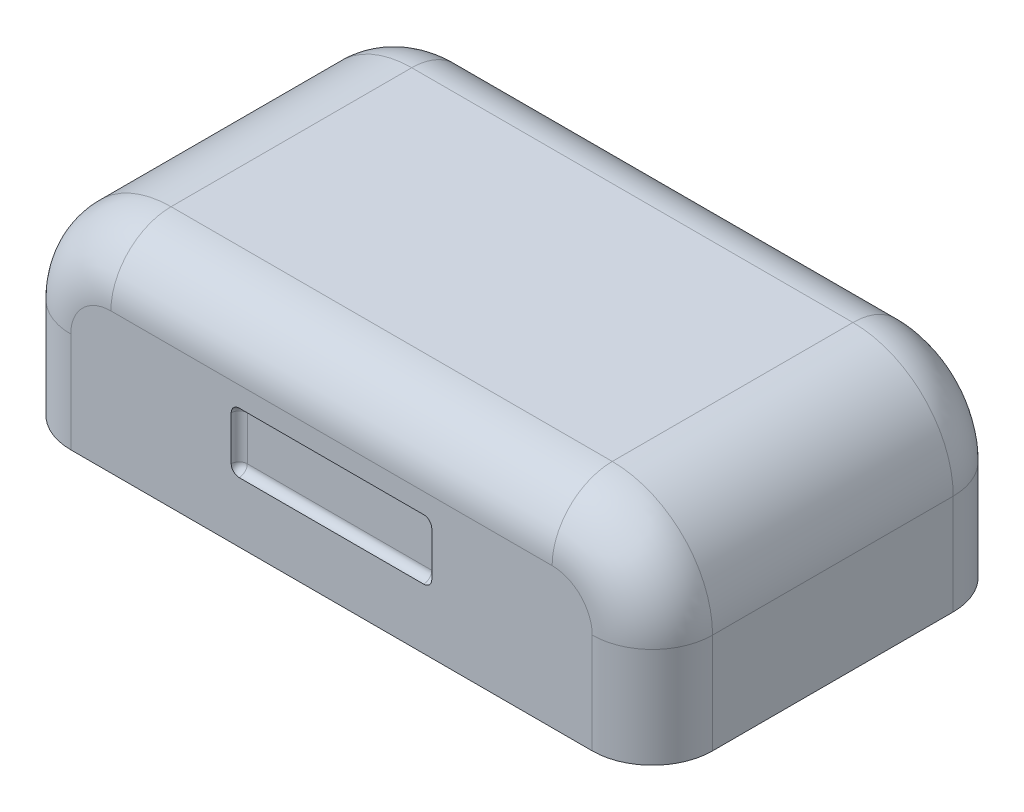
from build123d import *

# Parameters (mm, degrees)
ESQUISSE1_W             = 160
ESQUISSE1_H             = 90
EXTRUSION1_DEPTH        = 50
CONG_1_R                = 25
CONG_2_R                = 15
COQUE1_T                = -3
ESQUISSE2_W             = 50
ESQUISSE2_H             = 15
ENL_V_MAT_EXTRU_1_DEPTH = 2
CONG_4_R                = 2
CONG_5_R                = 2
CONG_6_R                = 2
CONG_7_R                = 2
CONG_4_OF_SYM_TRIE1_R   = 2
CONG_5_OF_SYM_TRIE1_R   = 2
CONG_6_OF_SYM_TRIE1_R   = 2
CONG_7_OF_SYM_TRIE1_R   = 2


with BuildPart() as part:
    # Esquisse1 → Extrusion1 (new body)
    with BuildSketch(Plane(origin=(0, 0, 0), x_dir=(1, 0, 0), z_dir=(0, 1, 0))):
        with Locations((35.341232877, 23.705753425)):
            Rectangle(ESQUISSE1_W, ESQUISSE1_H)
    extrude(amount=EXTRUSION1_DEPTH)

    # Congé1
    cong_1_edges = [part.edges().sort_by_distance(p)[0] for p in [
        (115.341232877, 50, -23.705753425),
        (-44.658767123, 50, -23.705753425),
    ]]
    fillet(cong_1_edges, radius=CONG_1_R)

    # Congé2
    cong_2_edges = [part.edges().sort_by_distance(p)[0] for p in [
        (35.341232877, 50, 21.294246575),
        (35.341232877, 50, -68.705753425),
        (115.341232877, 12.5, 21.294246575),
        (-44.658767123, 12.5, 21.294246575),
        (108.018902406, 42.67766953, 21.294246575),
        (-37.336436653, 42.67766953, 21.294246575),
        (-44.658767123, 12.5, -68.705753425),
        (115.341232877, 12.5, -68.705753425),
        (108.018902406, 42.67766953, -68.705753425),
        (-37.336436653, 42.67766953, -68.705753425),
    ]]
    fillet(cong_2_edges, radius=CONG_2_R)

    # Coque1
    coque1_openings = [part.faces().sort_by_distance(p)[0] for p in [
        (35.341232877, 0, -23.705753425),
    ]]
    offset(amount=COQUE1_T, openings=coque1_openings, kind=Kind.INTERSECTION)

    # Esquisse2 → Enlèv. mat.-Extru.1 (cut)
    with BuildSketch(Plane.XY.offset(21.294246575)):
        with Locations((35.341232877, 22.5)):
            Rectangle(ESQUISSE2_W, ESQUISSE2_H)
    enl_v_mat_extru_1 = extrude(amount=-ENL_V_MAT_EXTRU_1_DEPTH, mode=Mode.SUBTRACT)

    # Congé4
    cong_4_edges = [part.edges().sort_by_distance(p)[0] for p in [
        (35.341232877, 15, 19.294246575),
    ]]
    fillet(cong_4_edges, radius=CONG_4_R - 0.0001)  # a hair under: the kernel refuses the full size

    # Congé5
    cong_5_edges = [part.edges().sort_by_distance(p)[0] for p in [
        (35.341232877, 30, 19.294246575),
    ]]
    fillet(cong_5_edges, radius=CONG_5_R - 0.0001)  # a hair under: the kernel refuses the full size

    # Congé6
    cong_6_edges = [part.edges().sort_by_distance(p)[0] for p in [
        (10.341232877, 15.585757148, 19.880003724),
        (10.341232877, 22.5, 19.294246575),
        (10.341232877, 29.414242852, 19.880003724),
    ]]
    fillet(cong_6_edges, radius=CONG_6_R - 0.0001)  # a hair under: the kernel refuses the full size

    # Congé7
    cong_7_edges = [part.edges().sort_by_distance(p)[0] for p in [
        (60.341232877, 22.5, 19.294246575),
        (60.341232877, 15.585757148, 19.880003724),
        (60.341232877, 29.414242852, 19.880003724),
    ]]
    fillet(cong_7_edges, radius=CONG_7_R - 0.0001)  # a hair under: the kernel refuses the full size

    # Symétrie1: Enlèv. mat.-Extru.1 across plane
    add(enl_v_mat_extru_1.mirror(Plane.XY.offset(-23.705753425)), mode=Mode.SUBTRACT)

    # Congé4 of Symétrie1
    cong_4_of_sym_trie1_edges = [part.edges().sort_by_distance(p)[0] for p in [
        (35.341232877, 15, -66.705753425),
    ]]
    fillet(cong_4_of_sym_trie1_edges, radius=CONG_4_OF_SYM_TRIE1_R - 0.0001)  # a hair under: the kernel refuses the full size

    # Congé5 of Symétrie1
    cong_5_of_sym_trie1_edges = [part.edges().sort_by_distance(p)[0] for p in [
        (35.341232877, 30, -66.705753425),
    ]]
    fillet(cong_5_of_sym_trie1_edges, radius=CONG_5_OF_SYM_TRIE1_R - 0.0001)  # a hair under: the kernel refuses the full size

    # Congé6 of Symétrie1
    cong_6_of_sym_trie1_edges = [part.edges().sort_by_distance(p)[0] for p in [
        (10.341232877, 15.585757148, -67.291510573),
        (10.341232877, 22.5, -66.705753425),
        (10.341232877, 29.414242852, -67.291510573),
    ]]
    fillet(cong_6_of_sym_trie1_edges, radius=CONG_6_OF_SYM_TRIE1_R - 0.0001)  # a hair under: the kernel refuses the full size

    # Congé7 of Symétrie1
    cong_7_of_sym_trie1_edges = [part.edges().sort_by_distance(p)[0] for p in [
        (60.341232877, 22.5, -66.705753425),
        (60.341232877, 15.585757148, -67.291510573),
        (60.341232877, 29.414242852, -67.291510573),
    ]]
    fillet(cong_7_of_sym_trie1_edges, radius=CONG_7_OF_SYM_TRIE1_R - 0.0001)  # a hair under: the kernel refuses the full size


solid = part.part
